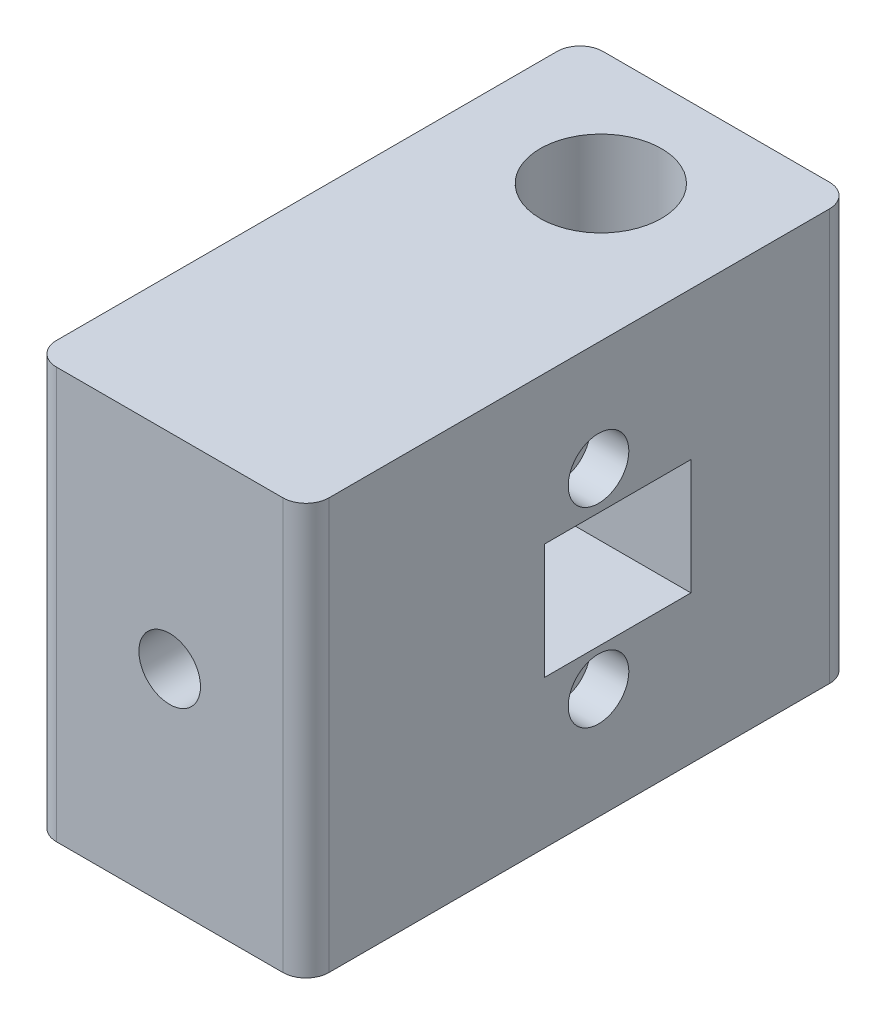
from build123d import *

# Parameters (mm, degrees)
SKETCH1_W           = 44.958
SKETCH1_H           = 67.818
BOSS_EXTRUDE1_DEPTH = 90.17
SKETCH2_R           = 5
CUT_EXTRUDE1_DEPTH  = 6.35
SKETCH3_R           = 4.064
CUT_EXTRUDE2_DEPTH  = 122.454237423
SKETCH4_R           = 9.9949
CUT_EXTRUDE3_DEPTH  = 15.24
SKETCH5_R           = 5.08
CUT_EXTRUDE4_DEPTH  = 50.8
SKETCH6_W           = 24.13
SKETCH6_H           = 19.05
CUT_EXTRUDE5_DEPTH  = 34.29
FILLET1_R           = 3.81


with BuildPart() as part:
    # Sketch1 → Boss-Extrude1 (new body)
    with BuildSketch(Plane.XY):
        with Locations((22.479, 33.909)):
            Rectangle(SKETCH1_W, SKETCH1_H)
    extrude(amount=BOSS_EXTRUDE1_DEPTH)

    # Sketch2 → Cut-Extrude1 (cut)
    with BuildSketch(Plane(origin=(44.958, 0, 0), x_dir=(0, 0, -1), z_dir=(1, 0, 0))):
        with Locations((-41.91, 49.788)):
            Circle(SKETCH2_R)
        with Locations((-41.91, 18.288)):
            Circle(SKETCH2_R)
    extrude(amount=-CUT_EXTRUDE1_DEPTH, mode=Mode.SUBTRACT)

    # Sketch3 → Cut-Extrude2 (cut, through all)
    with BuildSketch(Plane(origin=(0, 67.818, 0), x_dir=(1, 0, 0), z_dir=(0, 1, 0))):
        with Locations((22.479, -19.05)):
            Circle(SKETCH3_R)
    extrude(amount=-CUT_EXTRUDE2_DEPTH, mode=Mode.SUBTRACT)

    # Sketch4 → Cut-Extrude3 (cut)
    with BuildSketch(Plane(origin=(0, 67.818, 0), x_dir=(1, 0, 0), z_dir=(0, 1, 0))):
        with Locations((22.479, -19.05)):
            Circle(SKETCH4_R)
    extrude(amount=-CUT_EXTRUDE3_DEPTH, mode=Mode.SUBTRACT)

    # Sketch5 → Cut-Extrude4 (cut)
    with BuildSketch(Plane.XY.offset(90.17)):
        with Locations((22.479, 34.036)):
            Circle(SKETCH5_R)
    extrude(amount=-CUT_EXTRUDE4_DEPTH, mode=Mode.SUBTRACT)

    # Sketch6 → Cut-Extrude5 (cut)
    with BuildSketch(Plane(origin=(44.958, 0, 0), x_dir=(0, 0, -1), z_dir=(1, 0, 0))):
        with Locations((-38.735, 33.909)):
            Rectangle(SKETCH6_W, SKETCH6_H)
    extrude(amount=-CUT_EXTRUDE5_DEPTH, mode=Mode.SUBTRACT)

    # Fillet1
    fillet1_edges = [part.edges().sort_by_distance(p)[0] for p in [
        (0, 33.909, 0),
        (44.958, 33.909, 0),
        (0, 33.909, 90.17),
        (44.958, 33.909, 90.17),
    ]]
    fillet(fillet1_edges, radius=FILLET1_R)


solid = part.part
